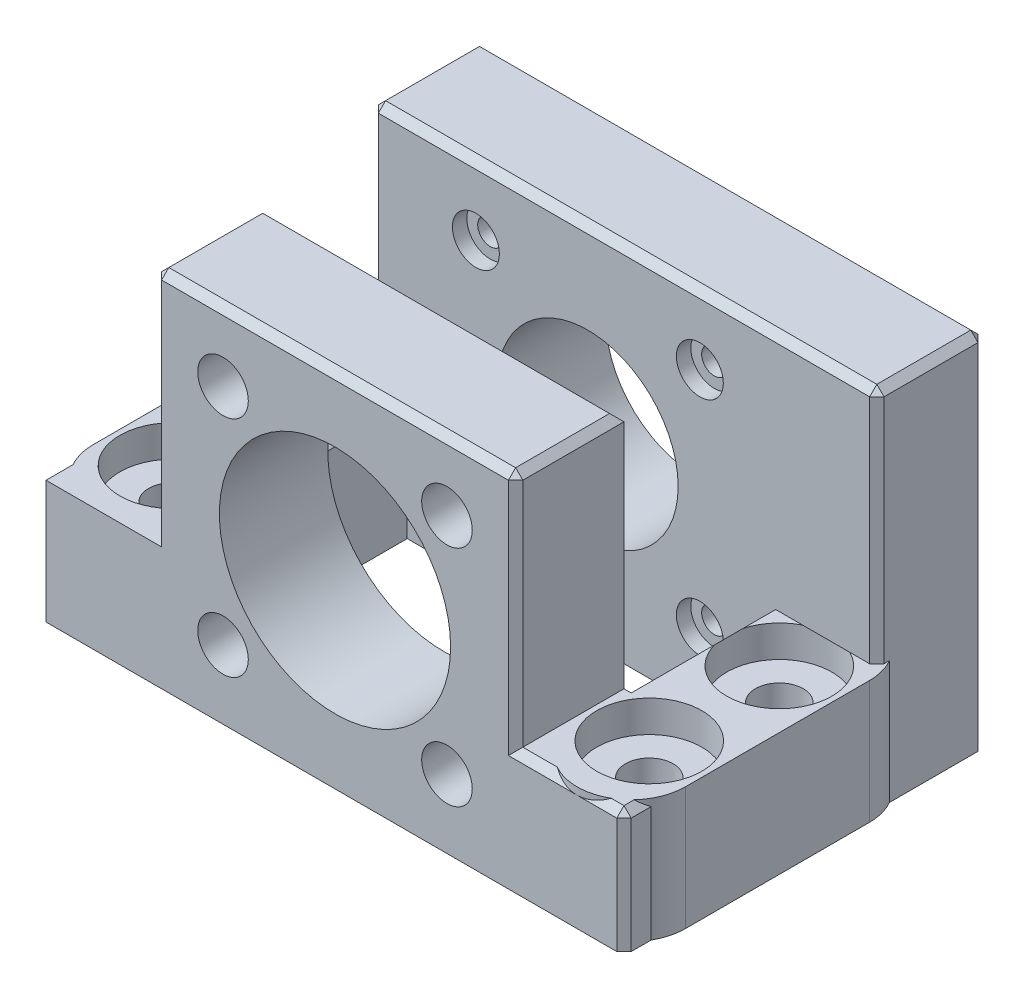
from build123d import *

# Parameters (mm, degrees)
SKETCH1_R                                   = 16
BOSS_EXTRUDE1_DEPTH                         = 7.5
SKETCH2_W                                   = 15
SKETCH2_H                                   = 17
BOSS_EXTRUDE2_DEPTH                         = 20
SKETCH3_W                                   = 70
SKETCH3_H                                   = 50
SKETCH3_R                                   = 12.5
SKETCH3_R_2                                 = 1.75
BOSS_EXTRUDE4_DEPTH                         = 15
CHAMFER1_SIZE                               = 1
CUT_EXTRUDE1_REACH                          = 72.373
SKETCH4_R                                   = 3.5
CBORE_FOR_M3_CHEESE_HEAD_SCREW3_D           = 3.4
CBORE_FOR_M3_CHEESE_HEAD_SCREW3_CBORE_D     = 6.5
CBORE_FOR_M3_CHEESE_HEAD_SCREW3_CBORE_DEPTH = 2
BOSS_EXTRUDE5_START                         = -17
BOSS_EXTRUDE5_DEPTH                         = 17
CBORE_FOR_M6_HEX_HEAD_BOLT1_AT_2_COUNT      = 2
CBORE_FOR_M6_HEX_HEAD_BOLT1_AT_2_PITCH      = 18
CBORE_FOR_M6_HEX_HEAD_BOLT1_AT_3_COUNT      = 2
CBORE_FOR_M6_HEX_HEAD_BOLT1_AT_3_PITCH      = 68.410525506
CBORE_FOR_M6_HEX_HEAD_BOLT1_AT_4_COUNT      = 2
CBORE_FOR_M6_HEX_HEAD_BOLT1_AT_4_PITCH      = 66


# Read off the part's stored shape, not the designer's step: Boss-Extrude5
with BuildPart() as part:
    # Sketch1 → Boss-Extrude1 (new, symmetric)
    with BuildSketch(Plane.XY):
        Polygon((-25, -20.805513048), (-40, -20.805513048), (-40, -3.805513048), (-25, -3.805513048), (-25, 29.194486952), (25, 29.194486952), (25, -3.805513048), (40, -3.805513048), (40, -20.805513048), (25, -20.805513048), align=None)
        with Locations((0, 4.194486952)):
            Circle(SKETCH1_R, mode=Mode.SUBTRACT)
    extrude(amount=BOSS_EXTRUDE1_DEPTH, both=True)

    # Sketch2 → Boss-Extrude2 (add)
    with BuildSketch(Plane(origin=(0, 0, -7.5), x_dir=(-1, 0, 0), z_dir=(0, 0, -1))):
        with Locations((32.5, -12.305513048)):
            Rectangle(SKETCH2_W, SKETCH2_H)
        with Locations((-32.5, -12.305513048)):
            Rectangle(SKETCH2_W, SKETCH2_H)
    extrude(amount=BOSS_EXTRUDE2_DEPTH)

    # Sketch3 → Boss-Extrude4 (add)
    with BuildSketch(Plane(origin=(0, 0, -27.5), x_dir=(-1, 0, 0), z_dir=(0, 0, -1))):
        with Locations((-5, 4.194486952)):
            Rectangle(SKETCH3_W, SKETCH3_H)
        with Locations((0, 4.194486952)):
            Circle(SKETCH3_R, mode=Mode.SUBTRACT)
        with Locations((15.5, 19.694486952)):
            Circle(SKETCH3_R_2, mode=Mode.SUBTRACT)
        with Locations((-15.5, 19.694486952)):
            Circle(SKETCH3_R_2, mode=Mode.SUBTRACT)
        with Locations((15.5, -11.305513048)):
            Circle(SKETCH3_R_2, mode=Mode.SUBTRACT)
        with Locations((-15.5, -11.305513048)):
            Circle(SKETCH3_R_2, mode=Mode.SUBTRACT)
    extrude(amount=BOSS_EXTRUDE4_DEPTH)

    # Chamfer1
    chamfer1_edges = [part.edges().sort_by_distance(p)[0] for p in [
        (0, 29.194486952, -7.5),
        (-25, 29.194486952, 0),
        (25, 29.194486952, 0),
        (40, -3.805513048, -10),
        (40, -12.305513048, 7.5),
        (32.5, -3.805513048, 7.5),
        (25, 12.694486952, 7.5),
        (-25, -3.805513048, -17.5),
        (0, 29.194486952, 7.5),
        (25, -3.805513048, -17.5),
        (-25, 12.694486952, 7.5),
        (40, 12.694486952, -27.5),
        (5, 29.194486952, -27.5),
        (40, 4.194486952, -42.5),
        (40, 29.194486952, -35),
        (-30, 12.694486952, -27.5),
        (5, 29.194486952, -42.5),
        (-30, 29.194486952, -35),
        (-30, 4.194486952, -42.5),
    ]]
    chamfer(chamfer1_edges, length=CHAMFER1_SIZE)

    # Sketch4 → Cut-Extrude1 (cut, up to next)
    with BuildSketch(Plane.XY.offset(7.5), mode=Mode.PRIVATE) as cut_extrude1_sk1:
        with Locations((-15.5, 19.694486952)):
            Circle(SKETCH4_R)
    cut_extrude1_tool1 = extrude(cut_extrude1_sk1.sketch, amount=-CUT_EXTRUDE1_REACH, mode=Mode.PRIVATE) & part.part
    # Sketch4 → Cut-Extrude1 (cut, up to next)
    with BuildSketch(Plane.XY.offset(7.5), mode=Mode.PRIVATE) as cut_extrude1_sk2:
        with Locations((-15.5, -11.305513048)):
            Circle(SKETCH4_R)
    cut_extrude1_tool2 = extrude(cut_extrude1_sk2.sketch, amount=-CUT_EXTRUDE1_REACH, mode=Mode.PRIVATE) & part.part
    # Sketch4 → Cut-Extrude1 (cut, up to next)
    with BuildSketch(Plane.XY.offset(7.5), mode=Mode.PRIVATE) as cut_extrude1_sk3:
        with Locations((15.5, -11.305513048)):
            Circle(SKETCH4_R)
    cut_extrude1_tool3 = extrude(cut_extrude1_sk3.sketch, amount=-CUT_EXTRUDE1_REACH, mode=Mode.PRIVATE) & part.part
    # Sketch4 → Cut-Extrude1 (cut, up to next)
    with BuildSketch(Plane.XY.offset(7.5), mode=Mode.PRIVATE) as cut_extrude1_sk4:
        with Locations((15.5, 19.694486952)):
            Circle(SKETCH4_R)
    cut_extrude1_tool4 = extrude(cut_extrude1_sk4.sketch, amount=-CUT_EXTRUDE1_REACH, mode=Mode.PRIVATE) & part.part
    add(cut_extrude1_tool1.solids().sort_by_distance((-15.5, 19.694487, 7.5))[0], mode=Mode.SUBTRACT)
    add(cut_extrude1_tool2.solids().sort_by_distance((-15.5, -11.305513, 7.5))[0], mode=Mode.SUBTRACT)
    add(cut_extrude1_tool3.solids().sort_by_distance((15.5, -11.305513, 7.5))[0], mode=Mode.SUBTRACT)
    add(cut_extrude1_tool4.solids().sort_by_distance((15.5, 19.694487, 7.5))[0], mode=Mode.SUBTRACT)

    # CBORE for M3 Cheese Head Screw3 (through all)
    with Locations(Plane(origin=(-15.5, 19.694486952, -27.5), x_dir=(1, 0, 0), z_dir=(0, 0, 1))):
        with Locations((0, 0), (31, 0), (0, -31), (31, -31)):
            CounterBoreHole(CBORE_FOR_M3_CHEESE_HEAD_SCREW3_D / 2, CBORE_FOR_M3_CHEESE_HEAD_SCREW3_CBORE_D / 2, CBORE_FOR_M3_CHEESE_HEAD_SCREW3_CBORE_DEPTH)

    # Boss-Extrude5 outline → Boss-Extrude5 (add)
    with BuildSketch(Plane(origin=(0, -3.805513048, 0), x_dir=(1, 0, 0), z_dir=(0, 1, 0)).offset(BOSS_EXTRUDE5_START)):
        with BuildLine():
            Line((-40, -3.741657387), (-40, 27.5))
            Line((-40, 27.5), (-30, 27.5))
            Line((-30, 27.5), (-30, 32.133249581))
            ThreePointArc((-30, 32.133249581), (-37.372983346, 31.922616289), (-41, 25.5))
            Line((-41, 25.5), (-41, 0))
            ThreePointArc((-41, 0), (-40.745688373, -1.936491673), (-40, -3.741657387))
        make_face()
        with BuildLine():
            Line((41, 0), (41, 25.5))
            ThreePointArc((41, 25.5), (28.196699141, 30.803300859), (33.5, 18))
            Line((33.5, 18), (33.5, 7.5))
            ThreePointArc((33.5, 7.5), (26.254311627, 1.936491673), (29.758342613, -6.5))
            ThreePointArc((29.758342613, -6.5), (33.5, -7.5), (37.241657387, -6.5))
            ThreePointArc((37.241657387, -6.5), (39.992781777, -3.754168989), (41, 0))
        make_face()
    extrude(amount=BOSS_EXTRUDE5_DEPTH)

    # Sketch9 → CBORE for M6 Hex Head Bolt1 (revolve, cut)
    with BuildSketch(Plane(origin=(-33, -3.805513048, -3), x_dir=(0, 0, 1), z_dir=(1, 0, 0))):
        Polygon((0, 0), (0, 17), (3.3, 17), (3.3, 4.38), (7.275, 4.38), (7.275, 0), align=None)
    cbore_for_m6_hex_head_bolt1 = revolve(axis=Axis((-33, 2.544486952, -3), (0, -1, 0)), mode=Mode.SUBTRACT)

    # CBORE for M6 Hex Head Bolt1 at 2: CBORE for M6 Hex Head Bolt1 ×2
    with Locations(*[(0, 0, -i * CBORE_FOR_M6_HEX_HEAD_BOLT1_AT_2_PITCH) for i in range(1, CBORE_FOR_M6_HEX_HEAD_BOLT1_AT_2_COUNT)]):
        add(cbore_for_m6_hex_head_bolt1, mode=Mode.SUBTRACT)

    # CBORE for M6 Hex Head Bolt1 at 3: CBORE for M6 Hex Head Bolt1 ×2
    with Locations(*[Vector(0.9647638212377322, 0, -0.26311740579210874) * (i * CBORE_FOR_M6_HEX_HEAD_BOLT1_AT_3_PITCH) for i in range(1, CBORE_FOR_M6_HEX_HEAD_BOLT1_AT_3_COUNT)]):
        add(cbore_for_m6_hex_head_bolt1, mode=Mode.SUBTRACT)

    # CBORE for M6 Hex Head Bolt1 at 4: CBORE for M6 Hex Head Bolt1 ×2
    with Locations(*[(i * CBORE_FOR_M6_HEX_HEAD_BOLT1_AT_4_PITCH, 0, 0) for i in range(1, CBORE_FOR_M6_HEX_HEAD_BOLT1_AT_4_COUNT)]):
        add(cbore_for_m6_hex_head_bolt1, mode=Mode.SUBTRACT)


solid = part.part
